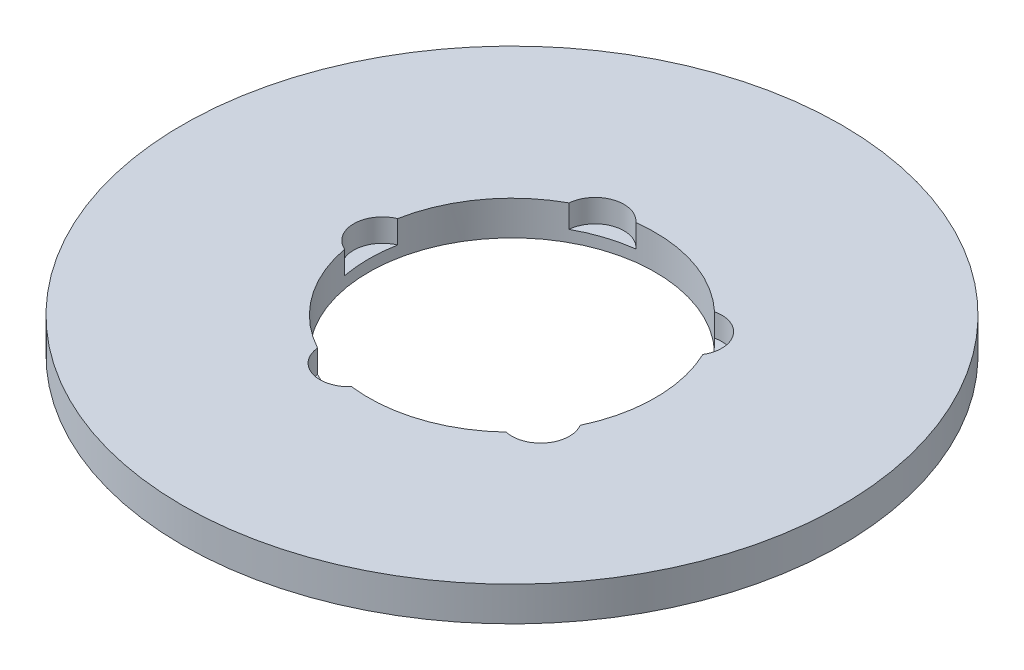
from build123d import *

# Parameters (mm, degrees)
SKETCH1_R           = 57.5
BOSS_EXTRUDE1_DEPTH = 6
SKETCH2_R           = 25
CUT_EXTRUDE1_DEPTH  = 82.538334543
SKETCH3_R           = 5.027876652
CUT_EXTRUDE2_DEPTH  = 3.995055634
CIRPATTERN1_COUNT   = 5


with BuildPart() as part:
    # Sketch1 → Boss-Extrude1 (new body)
    with BuildSketch(Plane(origin=(0, 0, 0), x_dir=(1, 0, 0), z_dir=(0, 1, 0))):
        Circle(SKETCH1_R)
    extrude(amount=BOSS_EXTRUDE1_DEPTH)

    # Sketch2 → Cut-Extrude1 (cut, through all)
    with BuildSketch(Plane(origin=(0, 0, 0), x_dir=(1, 0, 0), z_dir=(0, 1, 0))):
        Circle(SKETCH2_R)
    extrude(amount=CUT_EXTRUDE1_DEPTH, mode=Mode.SUBTRACT)

    # Sketch3 → Cut-Extrude2 (cut)
    with BuildSketch(Plane(origin=(0, 6, 0), x_dir=(1, 0, 0), z_dir=(0, 1, 0))):
        with Locations((-22.595346351, 0)):
            Circle(SKETCH3_R)
    cut_extrude2 = extrude(amount=-CUT_EXTRUDE2_DEPTH, mode=Mode.SUBTRACT)

    # CirPattern1: Cut-Extrude2 ×5 about axis
    cirpattern1_axis = Axis((0, 0, 0), (0, 1, 0))
    for i in range(1, CIRPATTERN1_COUNT):
        add(cut_extrude2.rotate(cirpattern1_axis, i * 360 / CIRPATTERN1_COUNT), mode=Mode.SUBTRACT)


solid = part.part
